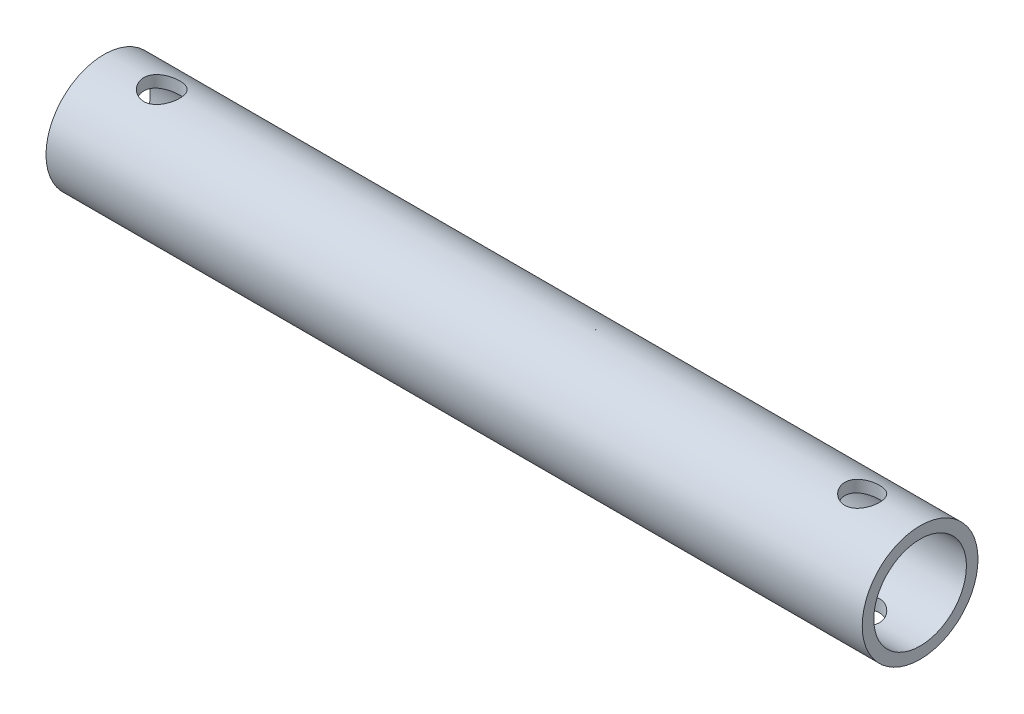
from build123d import *

# Parameters (mm, degrees)
SKETCH_1_R          = 10
SKETCH_1_R_2        = 8
EXTRUDE_1_DEPTH     = 107
EXTRUDE_START       = 34
SKETCH_2_R          = 10
SKETCH_2_R_2        = 8
EXTRUDE_2_DEPTH     = 34
SKETCH_3_R          = 3
CUT_EXTRUDE_1_DEPTH = 15
SKETCH_4_R          = 3.1
CUT_EXTRUDE_2_DEPTH = 10


with BuildPart() as part:
    # 草图1 → 凸台-拉伸1 (new body)
    with BuildSketch(Plane(origin=(0, 0, 0), x_dir=(0, 0, -1), z_dir=(1, 0, 0))):
        Circle(SKETCH_1_R)
        Circle(SKETCH_1_R_2, mode=Mode.SUBTRACT)
    extrude(amount=EXTRUDE_1_DEPTH)

    # 草图2 → 凸台-拉伸2 (add)
    with BuildSketch(Plane.ZY.offset(EXTRUDE_START)):
        Circle(SKETCH_2_R)
        Circle(SKETCH_2_R_2, mode=Mode.SUBTRACT)
    extrude(amount=-EXTRUDE_2_DEPTH)

    # 草图3 → 切除-拉伸1 (cut, symmetric)
    with BuildSketch(Plane(origin=(0, 0, 0), x_dir=(1, 0, 0), z_dir=(0, 1, 0))):
        with Locations((97, 0)):
            Circle(SKETCH_3_R)
    extrude(amount=CUT_EXTRUDE_1_DEPTH, both=True, mode=Mode.SUBTRACT)

    # 草图4 → 切除-拉伸2 (cut, symmetric)
    with BuildSketch(Plane(origin=(0, 0, 0), x_dir=(1, 0, 0), z_dir=(0, 1, 0))):
        with Locations((-24, 0)):
            Circle(SKETCH_4_R)
    extrude(amount=CUT_EXTRUDE_2_DEPTH, both=True, mode=Mode.SUBTRACT)


solid = part.part
